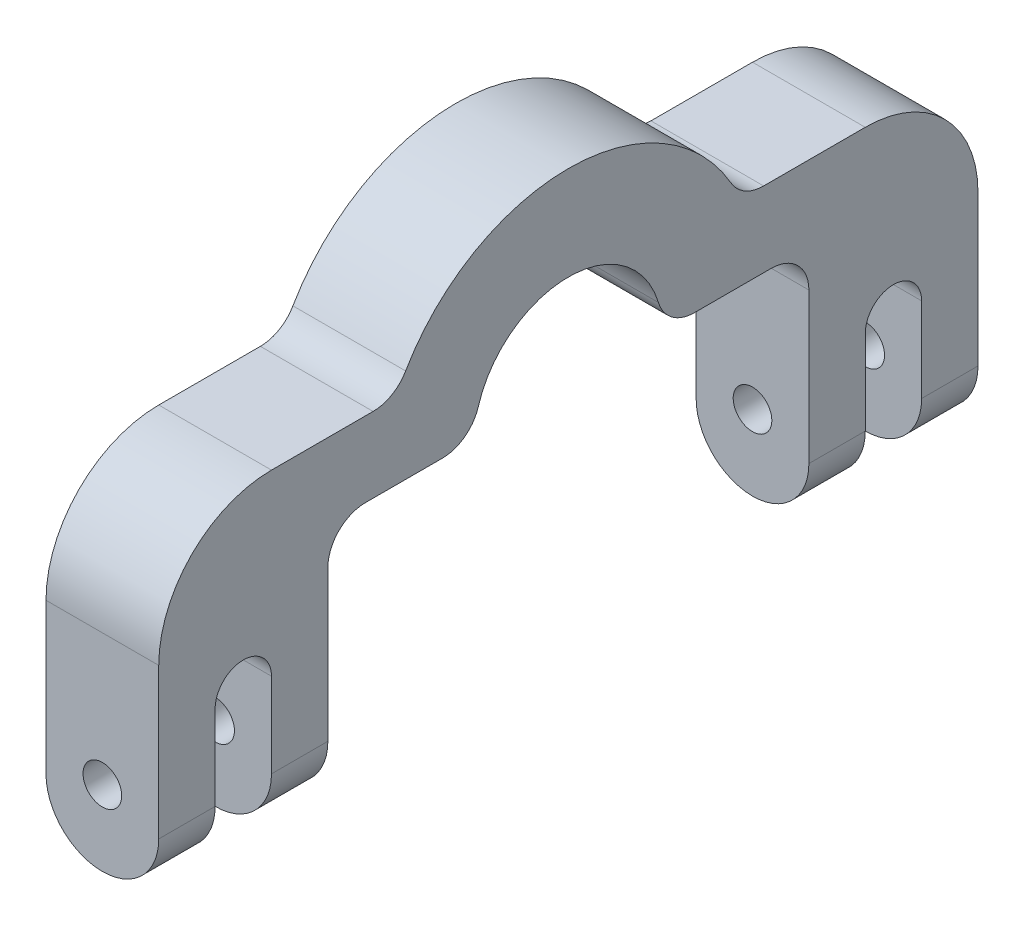
from build123d import *

# Parameters (mm, degrees)
BOSS_EXTRUDE1_DEPTH   = 34.6075
CUT_EXTRUDE1_START    = -4.7625
CUT_EXTRUDE1_DEPTH    = 4.7625
CUT_EXTRUDE2_START    = 9.525
CUT_EXTRUDE2_DEPTH    = 4.7625
CUT_EXTRUDE3_START    = -4.7625
CUT_EXTRUDE3_DEPTH    = 40.64
BOSS_EXTRUDE3_START   = 34.6075
SKETCH7_W             = 9.525
SKETCH7_H             = 6.35
BOSS_EXTRUDE3_DEPTH   = 69.215
FILLET1_R             = 3.175
FILLET2_R             = 2.38125
FILLET3_R             = 2.38125
BOSS_EXTRUDE4_DEPTH   = 9.525
CUT_EXTRUDE4_DEPTH    = 42.40423997
FILLET4_R             = 3.175
FILLET5_R             = 9.525
F_4_CLEARANCE_HOLE1_D = 3.2639


with BuildPart() as part:
    # Sketch1 → Boss-Extrude1 (new, symmetric)
    with BuildSketch(Plane.XY):
        with BuildLine():
            Line((-4.7625, 0), (4.7625, 0))
            Line((4.7625, 0), (4.7625, -15.875))
            ThreePointArc((4.7625, -15.875), (0, -20.6375), (-4.7625, -15.875))
            Line((-4.7625, -15.875), (-4.7625, 0))
        make_face()
    extrude(amount=BOSS_EXTRUDE1_DEPTH, both=True)

    # Sketch2 → Cut-Extrude1 (cut)
    with BuildSketch(Plane.XY.offset(34.6075).offset(CUT_EXTRUDE1_START)):
        with BuildLine():
            Line((-4.7625, -15.875), (-4.7625, -6.35))
            Line((-4.7625, -6.35), (4.7625, -6.35))
            Line((4.7625, -6.35), (4.7625, -15.875))
            ThreePointArc((4.7625, -15.875), (0, -20.6375), (-4.7625, -15.875))
        make_face()
    extrude(amount=-CUT_EXTRUDE1_DEPTH, mode=Mode.SUBTRACT)

    # Sketch3 → Cut-Extrude2 (cut)
    with BuildSketch(Plane.XY.offset(-34.6075).offset(CUT_EXTRUDE2_START)):
        with BuildLine():
            Line((-4.7625, -15.875), (-4.7625, -6.35))
            Line((-4.7625, -6.35), (4.7625, -6.35))
            Line((4.7625, -6.35), (4.7625, -15.875))
            ThreePointArc((4.7625, -15.875), (0, -20.6375), (-4.7625, -15.875))
        make_face()
    extrude(amount=-CUT_EXTRUDE2_DEPTH, mode=Mode.SUBTRACT)

    # Sketch5 → Cut-Extrude3 (cut)
    with BuildSketch(Plane.XY.offset(25.0825).offset(CUT_EXTRUDE3_START)):
        with BuildLine():
            Line((4.7625, -15.875), (4.7625, 0))
            Line((4.7625, 0), (-4.7625, 0))
            Line((-4.7625, 0), (-4.7625, -15.875))
            ThreePointArc((-4.7625, -15.875), (0, -20.6375), (4.7625, -15.875))
        make_face()
    extrude(amount=-CUT_EXTRUDE3_DEPTH, mode=Mode.SUBTRACT)


with BuildPart() as cut_extrude3_piece_1:
    # of the separate pieces the step leaves, piece 1, a body of its own (cut_extrude3_pieces)
    add(part.part.solids().sort_by_distance((-4.7625, 0, 20.32))[0])



with BuildPart() as cut_extrude3_piece_2:
    # of the separate pieces the step leaves, piece 2, a body of its own (cut_extrude3_pieces)
    add(part.part.solids().sort_by_distance((-4.7625, -15.875, -34.6075))[0])


with BuildPart() as cut_extrude3_piece_1_1:
    add(cut_extrude3_piece_1.part)

    add(cut_extrude3_piece_2.part)  # Boss-Extrude3 merges Cut-Extrude3 piece 2
    # Sketch7 → Boss-Extrude3 (add)
    with BuildSketch(Plane.XY.offset(BOSS_EXTRUDE3_START)):
        with Locations((0, 3.175)):
            Rectangle(SKETCH7_W, SKETCH7_H)
    extrude(amount=-BOSS_EXTRUDE3_DEPTH)

    # Fillet1
    fillet1_edges = [cut_extrude3_piece_1_1.edges().sort_by_distance(p)[0] for p in [
        (0, 0, 20.32),
        (0, 0, -20.32),
    ]]
    fillet(fillet1_edges, radius=FILLET1_R)

    # Fillet2
    fillet2_edges = [cut_extrude3_piece_1_1.edges().sort_by_distance(p)[0] for p in [
        (0, -6.35, -25.0825),
        (0, -6.35, -29.845),
    ]]
    fillet(fillet2_edges, radius=FILLET2_R - 0.0001)  # a hair under: the kernel refuses the full size

    # Fillet3
    fillet3_edges = [cut_extrude3_piece_1_1.edges().sort_by_distance(p)[0] for p in [
        (0, -6.35, 29.845),
        (0, -6.35, 25.0825),
    ]]
    fillet(fillet3_edges, radius=FILLET3_R - 0.0001)  # a hair under: the kernel refuses the full size

    # Sketch8 → Boss-Extrude4 (add)
    with BuildSketch(Plane.ZY.offset(4.7625)):
        with BuildLine():
            Line((-14.549677831, 6.35), (14.549677831, 6.35))
            ThreePointArc((14.549677831, 6.35), (0, 15.875), (-14.549677831, 6.35))
        make_face()
    extrude(amount=-BOSS_EXTRUDE4_DEPTH)

    # Sketch9 → Cut-Extrude4 (cut, through all)
    with BuildSketch(Plane.ZY.offset(4.7625)):
        with BuildLine():
            Line((-7.9375, 0), (7.9375, 0))
            ThreePointArc((7.9375, 0), (0, 7.9375), (-7.9375, 0))
        make_face()
    extrude(amount=-CUT_EXTRUDE4_DEPTH, mode=Mode.SUBTRACT)

    # Fillet4
    fillet4_edges = [cut_extrude3_piece_1_1.edges().sort_by_distance(p)[0] for p in [
        (0, 6.35, -14.549677831),
        (0, 6.35, 14.549677831),
        (0, 0, -7.9375),
        (0, 0, 7.9375),
    ]]
    fillet(fillet4_edges, radius=FILLET4_R)

    # Fillet5
    fillet5_edges = [cut_extrude3_piece_1_1.edges().sort_by_distance(p)[0] for p in [
        (0, 6.35, 34.6075),
        (0, 6.35, -34.6075),
    ]]
    fillet(fillet5_edges, radius=FILLET5_R)

    # #4 Clearance Hole1 (through all)
    with Locations(Plane(origin=(0, 0, -34.6075), x_dir=(-1, 0, 0), z_dir=(0, 0, -1))):
        with Locations((0, -14.2875)):
            Hole(F_4_CLEARANCE_HOLE1_D / 2)


solid = cut_extrude3_piece_1_1.part
